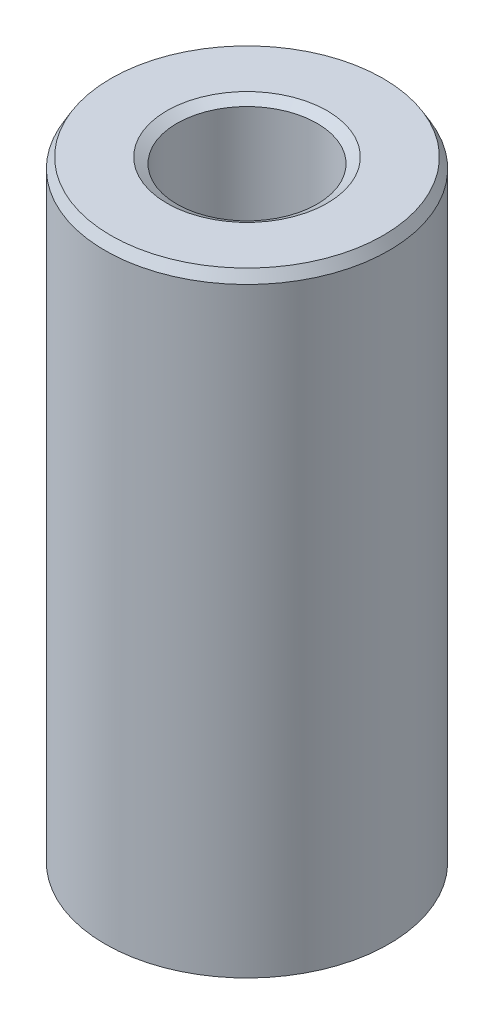
from build123d import *
from OCP.BRepFilletAPI import BRepFilletAPI_MakeChamfer

# Parameters (mm, degrees)
SKETCH1_R           = 5
BOSS_EXTRUDE1_DEPTH = 21.723398924
SKETCH2_R           = 2.468523633
CUT_EXTRUDE1_DEPTH  = 23.845263421
CHAMFER1_SIZE       = 0.356127096
CHAMFER1_SIZE2      = 0.205610075


with BuildPart() as part:
    # Sketch1 → Boss-Extrude1 (new body)
    with BuildSketch(Plane(origin=(0, 0, 0), x_dir=(1, 0, 0), z_dir=(0, 1, 0))):
        Circle(SKETCH1_R)
    extrude(amount=BOSS_EXTRUDE1_DEPTH)

    # Sketch2 → Cut-Extrude1 (cut, through all)
    with BuildSketch(Plane(origin=(0, 0, 0), x_dir=(1, 0, 0), z_dir=(0, 1, 0))):
        Circle(SKETCH2_R)
    extrude(amount=CUT_EXTRUDE1_DEPTH, mode=Mode.SUBTRACT)

    # Chamfer1: one chamfer whose edges measure the first distance from different faces: ONE call of the kernel's chamfer builder (chamfer() names one face for all edges)
    chamfer1_edges_1 = [part.edges().sort_by_distance(p)[0] for p in [
        (-2.468523633, 21.723398924, 0),
    ]]
    chamfer1_side_1 = [part.faces().sort_by_distance(p)[0] for p in [
        (-4.858578644, 21.723398924, 0),
    ]]
    chamfer1_edges_2 = [part.edges().sort_by_distance(p)[0] for p in [
        (-2.468523633, 0, 0),
    ]]
    chamfer1_side_2 = [part.faces().sort_by_distance(p)[0] for p in [
        (-2.468523633, 10.861699462, 0),
    ]]
    chamfer1_edges_3 = [part.edges().sort_by_distance(p)[0] for p in [
        (-5, 0, 0),
    ]]
    chamfer1_side_3 = [part.faces().sort_by_distance(p)[0] for p in [
        (-4.858578644, 0, 0),
    ]]
    chamfer1_edges_4 = [part.edges().sort_by_distance(p)[0] for p in [
        (-5, 21.723398924, 0),
    ]]
    chamfer1_side_4 = [part.faces().sort_by_distance(p)[0] for p in [
        (-5, 10.861699462, 0),
    ]]
    chamfer1 = BRepFilletAPI_MakeChamfer(part.part.solid().wrapped)
    for e in chamfer1_edges_1:
        chamfer1.Add(CHAMFER1_SIZE, CHAMFER1_SIZE2, e.wrapped, chamfer1_side_1[0].wrapped)  # the first distance lies on this face
    for e in chamfer1_edges_2:
        chamfer1.Add(CHAMFER1_SIZE, CHAMFER1_SIZE2, e.wrapped, chamfer1_side_2[0].wrapped)  # the first distance lies on this face
    for e in chamfer1_edges_3:
        chamfer1.Add(CHAMFER1_SIZE, CHAMFER1_SIZE2, e.wrapped, chamfer1_side_3[0].wrapped)  # the first distance lies on this face
    for e in chamfer1_edges_4:
        chamfer1.Add(CHAMFER1_SIZE, CHAMFER1_SIZE2, e.wrapped, chamfer1_side_4[0].wrapped)  # the first distance lies on this face
    add(Compound.cast(chamfer1.Shape()), mode=Mode.REPLACE)


solid = part.part
